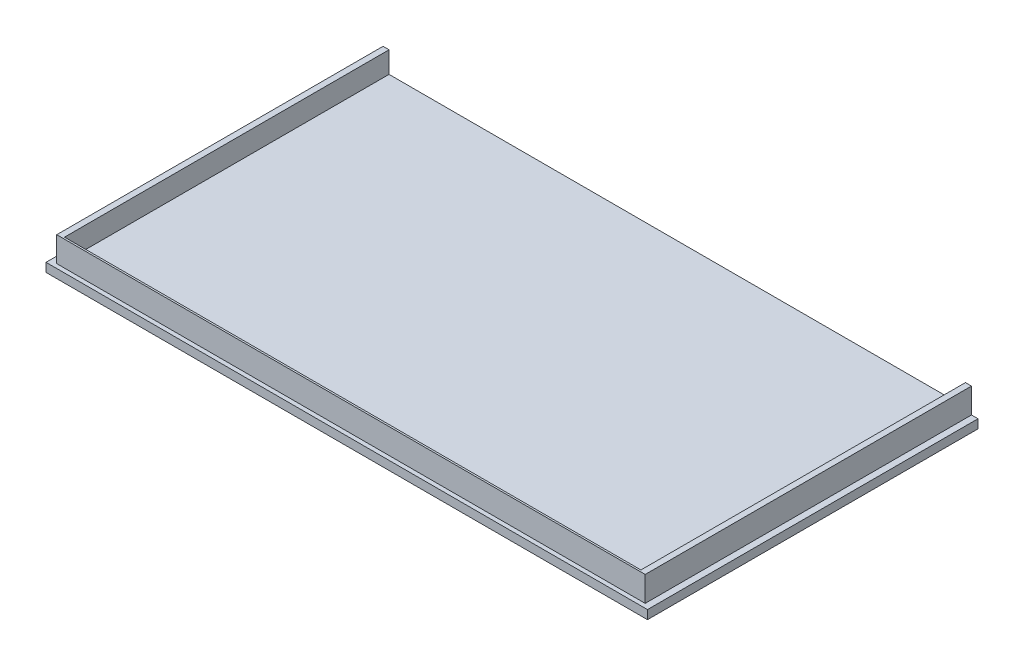
from build123d import *

# Parameters (mm, degrees)
SKETCH1_W           = 240
SKETCH1_H           = 351.15
BOSS_EXTRUDE3_DEPTH = 21
SKETCH5_W           = 248.975913499
SKETCH5_H           = 113.170869772
CUT_EXTRUDE5_DEPTH  = 254
CAVITY1_START       = -93.176553254
CAVITY1_DEPTH       = 230
SKETCH6_W           = 230
SKETCH6_H           = 2.384694545
CUT_EXTRUDE6_DEPTH  = 10
SKETCH7_W           = 329.692379319
SKETCH7_H           = 158.801284786
CUT_EXTRUDE8_DEPTH  = 33
CUT_EXTRUDE9_DEPTH  = 10


with BuildPart() as part:
    # Sketch1 → Boss-Extrude3 (new body)
    with BuildSketch(Plane(origin=(0, 0, 0), x_dir=(1, 0, 0), z_dir=(0, 1, 0))):
        with Locations((21.823446746, 98.176553254)):
            Rectangle(SKETCH1_W, SKETCH1_H)
    extrude(amount=BOSS_EXTRUDE3_DEPTH)

    # Sketch5 → Cut-Extrude5 (cut)
    with BuildSketch(Plane(origin=(0, 0, -54.481553254), x_dir=(-1, 0, 0), z_dir=(0, 0, -1))):
        with Locations((-20.8478358, 4.110963623)):
            Rectangle(SKETCH5_W, SKETCH5_H)
    extrude(amount=CUT_EXTRUDE5_DEPTH, mode=Mode.SUBTRACT)

    # Cavity1: read off the stored shape, not the designer's step
    # Cavity1 outline → Cavity1 (cut)
    with BuildSketch(Plane.YZ.offset(CAVITY1_START)):
        Polygon((18.5, 60.403141291), (13.5, 67.518446746), (13.5, 67.903141291), (18.5, 67.903141291), (13.5, 75.018446746), (5, 75.018446746), (5, -54.481553254), (13.5, -54.481553254), (13.5, -52.096858709), (18.5, -52.096858709), (13.5, -44.981553254), (13.5, -44.596858709), (18.5, -44.596858709), (13.5, -37.481553254), (13.5, -37.096858709), (18.5, -37.096858709), (13.5, -29.981553254), (13.5, -29.596858709), (18.5, -29.596858709), (13.5, -22.481553254), (13.5, -22.096858709), (18.5, -22.096858709), (13.5, -14.981553254), (13.5, -14.596858709), (18.5, -14.596858709), (13.5, -7.481553254), (13.5, -7.096858709), (18.5, -7.096858709), (13.5, 0.018446746), (13.5, 0.403141291), (18.5, 0.403141291), (13.5, 7.518446746), (13.5, 7.903141291), (18.5, 7.903141291), (13.5, 15.018446746), (13.5, 15.403141291), (18.5, 15.403141291), (13.5, 22.518446746), (13.5, 22.903141291), (18.5, 22.903141291), (13.5, 30.018446746), (13.5, 30.403141291), (18.5, 30.403141291), (13.5, 37.518446746), (13.5, 37.903141291), (18.5, 37.903141291), (13.5, 45.018446746), (13.5, 45.403141291), (18.5, 45.403141291), (13.5, 52.518446746), (13.5, 52.903141291), (18.5, 52.903141291), (13.5, 60.018446746), (13.5, 60.403141291), align=None)
    extrude(amount=CAVITY1_DEPTH, mode=Mode.SUBTRACT)

    # Sketch6 → Cut-Extrude6 (cut)
    with BuildSketch(Plane(origin=(0, 13.5, 0), x_dir=(-1, 0, 0), z_dir=(0, -1, 0))):
        with Locations((-21.823446746, 53.289205982)):
            Rectangle(SKETCH6_W, SKETCH6_H)
    extrude(amount=-CUT_EXTRUDE6_DEPTH, mode=Mode.SUBTRACT)

    # Sketch7 → Cut-Extrude8 (cut)
    with BuildSketch(Plane(origin=(0, 13.5, 0), x_dir=(-1, 0, 0), z_dir=(0, -1, 0))):
        with Locations((-33.84938791, -12.885366014)):
            Rectangle(SKETCH7_W, SKETCH7_H)
    extrude(amount=-CUT_EXTRUDE8_DEPTH, mode=Mode.SUBTRACT)

    # Sketch9 → Cut-Extrude9 (cut)
    with BuildSketch(Plane(origin=(0, 13.5, 0), x_dir=(1, 0, 0), z_dir=(0, 1, 0))):
        Polygon((139.223446746, 54.481553254), (139.223446746, -75.718446746), (-95.576553254, -75.718446746), (-95.576553254, 54.481553254), (-98.176553254, 54.481553254), (-98.176553254, -77.398446746), (141.823446746, -77.398446746), (141.823446746, 54.481553254), align=None)
    extrude(amount=-CUT_EXTRUDE9_DEPTH, mode=Mode.SUBTRACT)


solid = part.part
